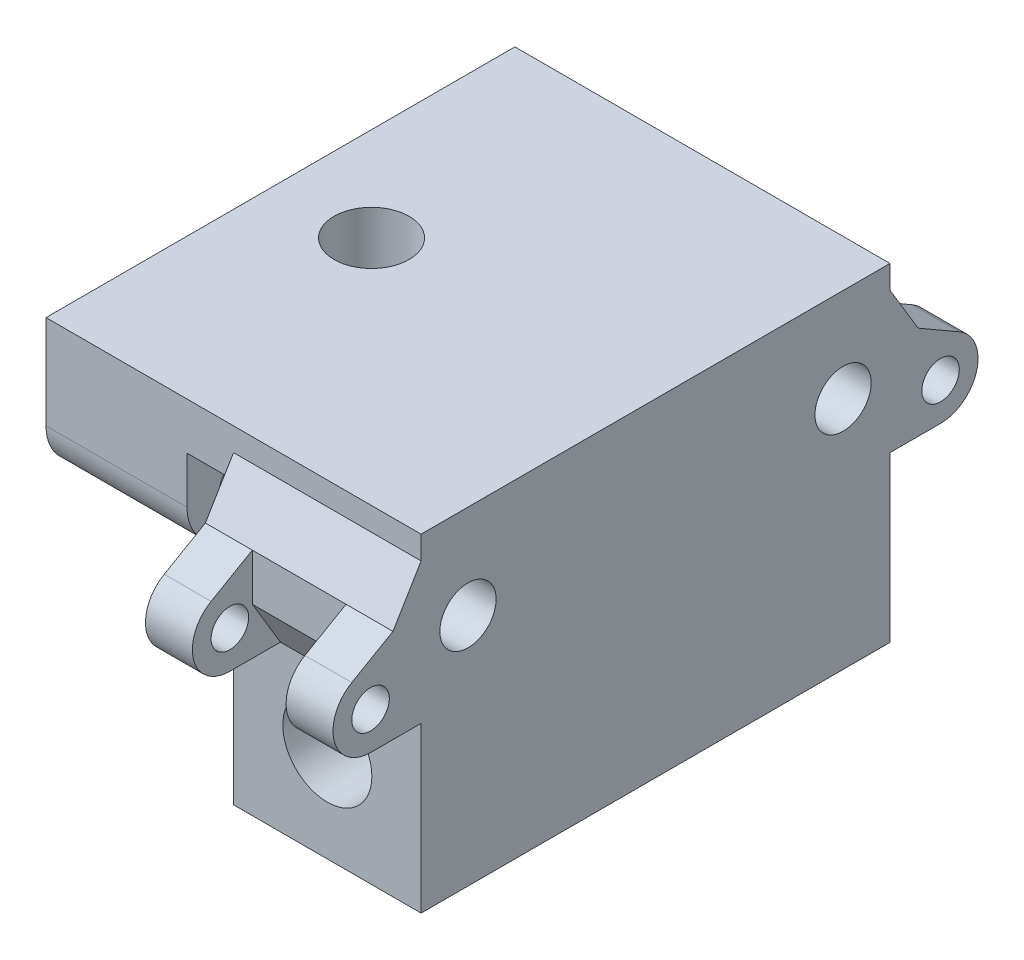
from build123d import *

# Parameters (mm, degrees)
SKETCH3_W              = 20
SKETCH3_H              = 50
BOSS_EXTRUDE1_DEPTH    = 35
SKETCH4_R              = 4.75
CUT_EXTRUDE1_DEPTH     = 60
SKETCH5_R              = 3
CUT_EXTRUDE2_DEPTH     = 60
EXTRUDE_2_DEPTH        = 20
SKETCH_3_R             = 2
EXTRUDE_4_DEPTH        = 5
PATTERN_LINEAR_1_COUNT = 2
PATTERN_LINEAR_1_PITCH = 15
SKETCH_5_W             = 20
SKETCH_5_H             = 50
EXTRUDE_5_DEPTH        = 15
SKETCH_6_W             = 4.961104437
SKETCH_6_H             = 10
CUT_EXTRUDE_1_DEPTH    = 10
SKETCH_7_R             = 1.5
CUT_EXTRUDE_2_DEPTH    = 20
SKETCH_8_R             = 4
CUT_EXTRUDE_3_DEPTH    = 20
FILLET_11_R            = 5
FILLET_12_R            = 5
FILLET_START           = -0.209677419
FILLET_13_DEPTH        = 30


with BuildPart() as part:
    # Sketch3 → Boss-Extrude1 (new body)
    with BuildSketch(Plane(origin=(0, 0, 0), x_dir=(1, 0, 0), z_dir=(0, 1, 0))):
        with Locations((-3.806451613, -14.790322581)):
            Rectangle(SKETCH3_W, SKETCH3_H)
    extrude(amount=BOSS_EXTRUDE1_DEPTH)

    # Sketch4 → Cut-Extrude1 (cut)
    with BuildSketch(Plane.XY.offset(39.790322581)):
        with Locations((-3.806451613, 10)):
            Circle(SKETCH4_R)
    extrude(amount=-CUT_EXTRUDE1_DEPTH, mode=Mode.SUBTRACT)

    # Sketch5 → Cut-Extrude2 (cut)
    with BuildSketch(Plane(origin=(6.193548387, 0, 0), x_dir=(0, 0, -1), z_dir=(1, 0, 0))):
        with Locations((-34.790322581, 25)):
            Circle(SKETCH5_R)
        with Locations((5.209677419, 25)):
            Circle(SKETCH5_R)
    extrude(amount=-CUT_EXTRUDE2_DEPTH, mode=Mode.SUBTRACT)

    # 草圖2 → 填料-伸長2 (add)
    with BuildSketch(Plane(origin=(6.193548387, 0, 0), x_dir=(0, 0, -1), z_dir=(1, 0, 0))):
        Polygon((10.209677419, 32.525099494), (10.209677419, 17.525099494), (13.209677419, 22.525099494), (13.209677419, 27.525099494), align=None)
        Polygon((-39.790322581, 17.525099494), (-42.790322581, 22.525099494), (-42.790322581, 27.525099494), (-39.790322581, 32.525099494), align=None)
    extrude(amount=-EXTRUDE_2_DEPTH)

    # 草圖3 → 填料-伸長4 (add)
    # profile 1 of 2: a face of its own
    with BuildSketch(Plane(origin=(6.193548387, 0, 0), x_dir=(0, 0, -1), z_dir=(1, 0, 0))):
        with BuildLine():
            Line((13.209677419, 27.525099494), (17.601982265, 24.989201109))
            ThreePointArc((17.601982265, 24.989201109), (19.46568557, 20.489823314), (15.601982265, 17.525099494))
            Line((15.601982265, 17.525099494), (10.209677419, 17.525099494))
            Line((10.209677419, 17.525099494), (13.209677419, 22.525099494))
            Line((13.209677419, 22.525099494), (13.209677419, 27.525099494))
        make_face()
        with Locations((15.601982265, 21.525099494)):
            Circle(SKETCH_3_R, mode=Mode.SUBTRACT)
    # profile 2 of 2: a face of its own
    with BuildSketch(Plane(origin=(6.193548387, 0, 0), x_dir=(0, 0, -1), z_dir=(1, 0, 0))):
        with BuildLine():
            Line((-39.790322581, 17.525099494), (-45.182627426, 17.525099494))
            ThreePointArc((-45.182627426, 17.525099494), (-49.046330731, 20.489823314), (-47.182627426, 24.989201109))
            Line((-47.182627426, 24.989201109), (-42.790322581, 27.525099494))
            Line((-42.790322581, 27.525099494), (-42.790322581, 22.525099494))
            Line((-42.790322581, 22.525099494), (-39.790322581, 17.525099494))
        make_face()
        with Locations(Location((-45.182627426, 21.525099494, 0), (0, 0, 180))):
            Circle(SKETCH_3_R, mode=Mode.SUBTRACT)
    extrude_4 = extrude(amount=-EXTRUDE_4_DEPTH)

    # 直線複製排列1: 填料-伸長4 ×2
    with Locations(*[(-i * PATTERN_LINEAR_1_PITCH, 0, 0) for i in range(1, PATTERN_LINEAR_1_COUNT)]):
        add(extrude_4)

    # 草圖5 → 填料-伸長5 (add)
    with BuildSketch(Plane(origin=(0, 35, 0), x_dir=(1, 0, 0), z_dir=(0, 1, 0))):
        with Locations((-23.806451613, -14.790322581)):
            Rectangle(SKETCH_5_W, SKETCH_5_H)
    extrude(amount=-EXTRUDE_5_DEPTH)

    # 草圖6 → 除料-伸長1 (cut)
    with BuildSketch(Plane.XZ.offset(-20)):
        with Locations((-16.287003832, -5.209677419)):
            Rectangle(SKETCH_6_W, SKETCH_6_H)
        with Locations((-16.287003832, 34.790322581)):
            Rectangle(SKETCH_6_W, SKETCH_6_H)
    extrude(amount=-CUT_EXTRUDE_1_DEPTH, mode=Mode.SUBTRACT)

    # 草圖7 → 除料-伸長2 (cut)
    with BuildSketch(Plane.ZY.offset(33.806451613)):
        with Locations((-5.209677419, 25)):
            Circle(SKETCH_7_R)
        with Locations((34.790322581, 25)):
            Circle(SKETCH_7_R)
    extrude(amount=-CUT_EXTRUDE_2_DEPTH, mode=Mode.SUBTRACT)

    # 草圖8 → 除料-伸長3 (cut)
    with BuildSketch(Plane(origin=(0, 35, 0), x_dir=(1, 0, 0), z_dir=(0, 1, 0))):
        with Locations(Location((-23.806451613, -15.073492492, 0), (0, 0, 270))):
            Circle(SKETCH_8_R)
    extrude(amount=-CUT_EXTRUDE_3_DEPTH, mode=Mode.SUBTRACT)

    # 圓角11
    fillet_11_edges = [part.edges().sort_by_distance(p)[0] for p in [
        (-26.287003832, 20, -10.209677419),
    ]]
    fillet(fillet_11_edges, radius=FILLET_11_R)

    # 圓角12
    fillet_12_edges = [part.edges().sort_by_distance(p)[0] for p in [
        (-26.287003832, 20, 39.790322581),
    ]]
    fillet(fillet_12_edges, radius=FILLET_12_R)

    # 圓角13: read off the stored shape, not the designer's step
    # 圓角13 outline → 圓角13 (add)
    with BuildSketch(Plane.XY.offset(FILLET_START)):
        with BuildLine():
            Line((-13.806451613, 20), (-17.341985519, 20))
            ThreePointArc((-17.341985519, 20), (-14.841985519, 18.964466094), (-13.806451613, 16.464466094))
            Line((-13.806451613, 16.464466094), (-13.806451613, 20))
        make_face()
    extrude(amount=FILLET_13_DEPTH)


solid = part.part
